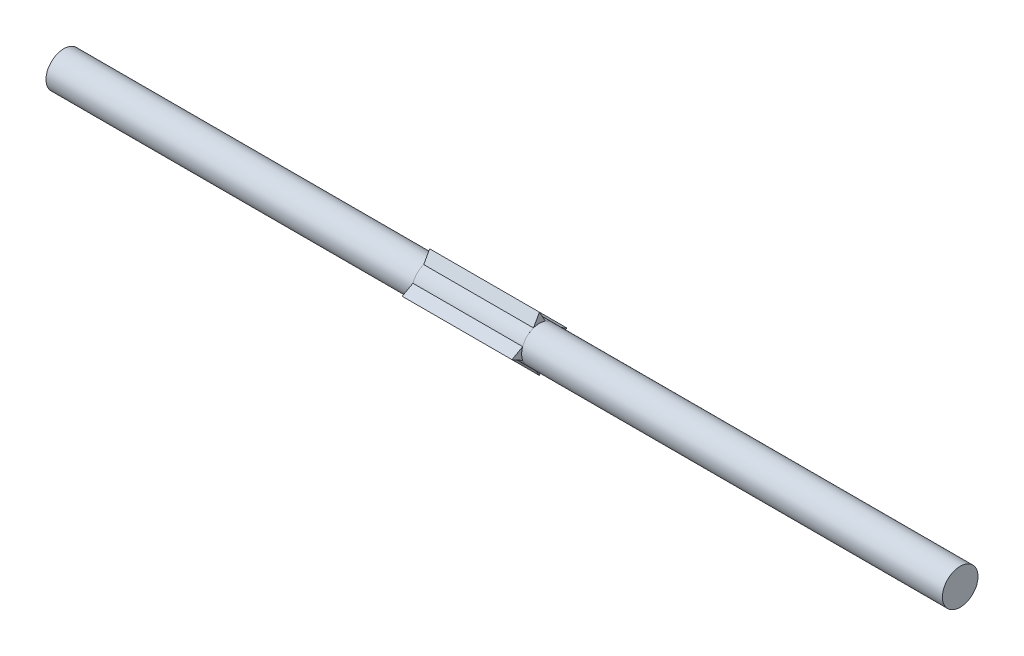
from build123d import *
from build123d.topology import SkipClean

# Parameters (mm, degrees)
SKETCH1_W           = 230
SKETCH1_H           = 4.8625
BOSS_EXTRUDE1_DEPTH = 15
SPLIT1_START        = -115
SPLIT1_OUTLINE_R    = 4.8625
SPLIT1_DEPTH        = 100
SPLIT1_START_2      = 15
SPLIT1_2_OUTLINE_R  = 4.8625
SPLIT1_2_DEPTH      = 100
SPLIT1_3_OUTLINE_R  = 4.8625
SPLIT1_3_DEPTH      = 100
SPLIT1_4_OUTLINE_R  = 4.8625
SPLIT1_4_DEPTH      = 100
BOSS_EXTRUDE2_START = 15
SKETCH3_R           = 4.8625
BOSS_EXTRUDE2_DEPTH = 15


# Read off the part's stored shape, not the designer's step: Split1
with BuildPart() as part:
    # Sketch1 → Revolve2 (revolve)
    with BuildSketch(Plane(origin=(0, 0, 0), x_dir=(1, 0, 0), z_dir=(0, 1, 0))):
        with Locations((0, -2.43125)):
            Rectangle(SKETCH1_W, SKETCH1_H)
    revolve(axis=Axis((-115, 0, 0), (1, 0, 0)))

    # Sketch2 → Boss-Extrude1 (add, symmetric)
    with SkipClean():  # the faces are left unmerged after this step: merging them gives an invalid solid
        with BuildSketch(Plane(origin=(0, 0, 0), x_dir=(0, 0, -1), z_dir=(1, 0, 0))):
            with BuildLine():
                Line((0, 7.5), (-1.6323529, 4.580319886))
                ThreePointArc((-1.6323529, 4.580319886), (-3.438306724, 3.438306724), (-4.580319886, 1.6323529))
                Line((-4.580319886, 1.6323529), (-7.5, 0))
                Line((-7.5, 0), (-4.580319886, -1.6323529))
                ThreePointArc((-4.580319886, -1.6323529), (-3.438306724, -3.438306724), (-1.6323529, -4.580319886))
                Line((-1.6323529, -4.580319886), (0, -7.5))
                Line((0, -7.5), (1.6323529, -4.580319886))
                ThreePointArc((1.6323529, -4.580319886), (3.438306724, -3.438306724), (4.580319886, -1.6323529))
                Line((4.580319886, -1.6323529), (7.5, 0))
                Line((7.5, 0), (4.580319886, 1.6323529))
                ThreePointArc((4.580319886, 1.6323529), (3.438306724, 3.438306724), (1.6323529, 4.580319886))
                Line((1.6323529, 4.580319886), (0, 7.5))
            make_face()
        extrude(amount=BOSS_EXTRUDE1_DEPTH, both=True)

    # Split1 outline → Split1 (cut)
    with SkipClean():  # the faces are left unmerged after this step: merging them gives an invalid solid
        with BuildSketch(Plane.YZ.offset(SPLIT1_START)):
            Circle(SPLIT1_OUTLINE_R)
        extrude(amount=SPLIT1_DEPTH, mode=Mode.SUBTRACT)

    # Split1 2 outline → Split1 2 (cut)
    with BuildSketch(Plane.YZ.offset(SPLIT1_START_2)):
        Circle(SPLIT1_2_OUTLINE_R)
    extrude(amount=SPLIT1_2_DEPTH, mode=Mode.SUBTRACT)


with BuildPart() as body_2:
    # Split1 3 outline → Split1 3 (new body)
    with BuildSketch(Plane.YZ.offset(SPLIT1_START_2)):
        Circle(SPLIT1_3_OUTLINE_R)
    extrude(amount=SPLIT1_3_DEPTH)

    # Sketch3 → Boss-Extrude2 (add)
    with BuildSketch(Plane(origin=(115, 0, 0), x_dir=(0, 0, -1), z_dir=(1, 0, 0)).offset(BOSS_EXTRUDE2_START)):
        Circle(SKETCH3_R)
    extrude(amount=-BOSS_EXTRUDE2_DEPTH)


with BuildPart() as body_3:
    # Split1 4 outline → Split1 4 (new body)
    with BuildSketch(Plane.YZ.offset(SPLIT1_START)):
        Circle(SPLIT1_4_OUTLINE_R)
    extrude(amount=SPLIT1_4_DEPTH)


solid = Compound([part.part, body_2.part, body_3.part])
